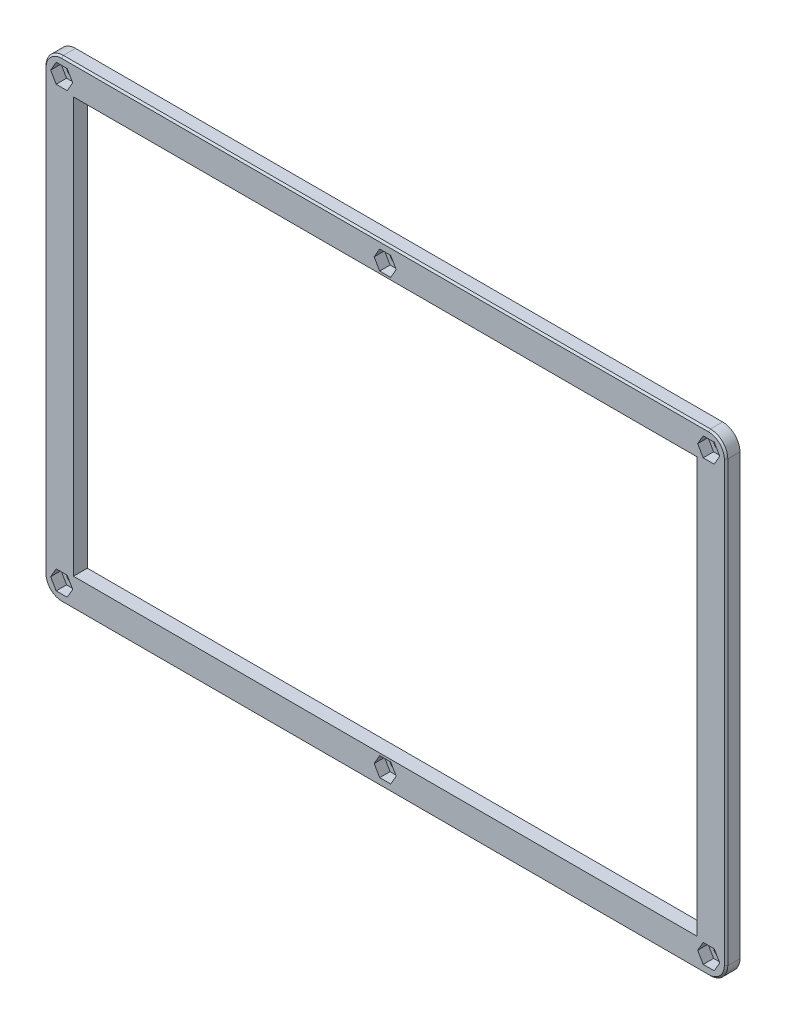
from build123d import *

# Parameters (mm, degrees)
CROQUIS1_W              = 179.6
CROQUIS1_H              = 119.6
CROQUIS1_W_2            = 176.4
CROQUIS1_H_2            = 116.4
SALIENTE_EXTRUIR1_DEPTH = 40
CROQUIS2_W              = 196.4
CROQUIS2_H              = 136.4
CROQUIS2_W_2            = 176.4
CROQUIS2_H_2            = 116.4
SALIENTE_EXTRUIR2_DEPTH = 4
CROQUIS10_W             = 179.6
CROQUIS10_H             = 119.6
CORTAR_EXTRUIR6_DEPTH   = 128.398901094
CROQUIS7_R              = 1.6
CORTAR_EXTRUIR3_DEPTH   = 120.626418487
CORTAR_EXTRUIR5_START   = -1
CORTAR_EXTRUIR5_DEPTH   = 119.626418487
REDONDEO1_R             = 5
CHAFL_N2_SIZE           = 0.5
CHAFL_N3_SIZE           = 1


with BuildPart() as part:
    # Croquis1 → Saliente-Extruir1 (new body)
    with BuildSketch(Plane.XY):
        Rectangle(CROQUIS1_W, CROQUIS1_H)
        Rectangle(CROQUIS1_W_2, CROQUIS1_H_2, mode=Mode.SUBTRACT)
    extrude(amount=SALIENTE_EXTRUIR1_DEPTH)

    # Croquis2 → Saliente-Extruir2 (add)
    with BuildSketch(Plane(origin=(0, 0, 0), x_dir=(-1, 0, 0), z_dir=(0, 0, -1))):
        Rectangle(CROQUIS2_W, CROQUIS2_H)
        Rectangle(CROQUIS2_W_2, CROQUIS2_H_2, mode=Mode.SUBTRACT)
    extrude(amount=SALIENTE_EXTRUIR2_DEPTH)

    # Croquis10 → Cortar-Extruir6 (cut, through all)
    with BuildSketch(Plane.XY.offset(40)):
        Rectangle(CROQUIS10_W, CROQUIS10_H)
    extrude(amount=-CORTAR_EXTRUIR6_DEPTH, mode=Mode.SUBTRACT)

    # Croquis7 → Cortar-Extruir3 (cut, through all)
    with BuildSketch(Plane(origin=(0, 0, -4), x_dir=(-1, 0, 0), z_dir=(0, 0, -1))):
        with Locations((0, 63.2)):
            Circle(CROQUIS7_R)
        with Locations((93.2, 63.2)):
            Circle(CROQUIS7_R)
        with Locations(Location((-93.2, 63.2, 0), (0, 0, 180))):
            Circle(CROQUIS7_R)
        with Locations((-93.2, -63.2)):
            Circle(CROQUIS7_R)
        with Locations(Location((93.2, -63.2, 0), (0, 0, 180))):
            Circle(CROQUIS7_R)
        with Locations(Location((0, -63.2, 0), (0, 0, 180))):
            Circle(CROQUIS7_R)
    extrude(amount=-CORTAR_EXTRUIR3_DEPTH, mode=Mode.SUBTRACT)

    # Croquis9 → Cortar-Extruir5 (cut, through all)
    with BuildSketch(Plane(origin=(0, 0, -4), x_dir=(-1, 0, 0), z_dir=(0, 0, -1)).offset(CORTAR_EXTRUIR5_START)):
        Polygon((-90.024573519, 63.2), (-91.61228676, 65.95), (-94.78771324, 65.95), (-96.375426481, 63.2), (-94.78771324, 60.45), (-91.61228676, 60.45), align=None)
        Polygon((3.175426481, 63.2), (1.58771324, 65.95), (-1.58771324, 65.95), (-3.175426481, 63.2), (-1.58771324, 60.45), (1.58771324, 60.45), align=None)
        Polygon((3.175426481, -63.2), (1.58771324, -60.45), (-1.58771324, -60.45), (-3.175426481, -63.2), (-1.58771324, -65.95), (1.58771324, -65.95), align=None)
        Polygon((-90.024573519, -63.2), (-91.61228676, -60.45), (-94.78771324, -60.45), (-96.375426481, -63.2), (-94.78771324, -65.95), (-91.61228676, -65.95), align=None)
        Polygon((96.375426481, -63.2), (94.78771324, -60.45), (91.61228676, -60.45), (90.024573519, -63.2), (91.61228676, -65.95), (94.78771324, -65.95), align=None)
        Polygon((96.375426481, 63.2), (94.78771324, 65.95), (91.61228676, 65.95), (90.024573519, 63.2), (91.61228676, 60.45), (94.78771324, 60.45), align=None)
    extrude(amount=-CORTAR_EXTRUIR5_DEPTH, mode=Mode.SUBTRACT)

    # Redondeo1
    redondeo1_edges = [part.edges().sort_by_distance(p)[0] for p in [
        (-98.2, -68.2, -2),
        (-98.2, 68.2, -2),
        (98.2, 68.2, -2),
        (98.2, -68.2, -2),
    ]]
    fillet(redondeo1_edges, radius=REDONDEO1_R)

    # Chaflán2
    chafl_n2_edges = [part.edges().sort_by_distance(p)[0] for p in [
        (98.2, 0, 0),
        (-98.2, 0, 0),
        (0, -68.2, 0),
        (0, 68.2, 0),
        (-96.735533906, 66.735533906, 0),
        (-96.735533906, -66.735533906, 0),
        (96.735533906, -66.735533906, 0),
        (96.735533906, 66.735533906, 0),
    ]]
    chamfer(chafl_n2_edges, length=CHAFL_N2_SIZE)

    # Chaflán3
    chafl_n3_edges = [part.edges().sort_by_distance(p)[0] for p in [
        (-91.6, 63.2, -4),
        (91.6, 63.2, -4),
        (94.8, -63.2, -4),
        (-94.8, -63.2, -4),
        (-1.6, -63.2, -4),
        (1.6, 63.2, -4),
    ]]
    chamfer(chafl_n3_edges, length=CHAFL_N3_SIZE - 0.0001)  # a hair under: the kernel refuses the full size


solid = part.part
